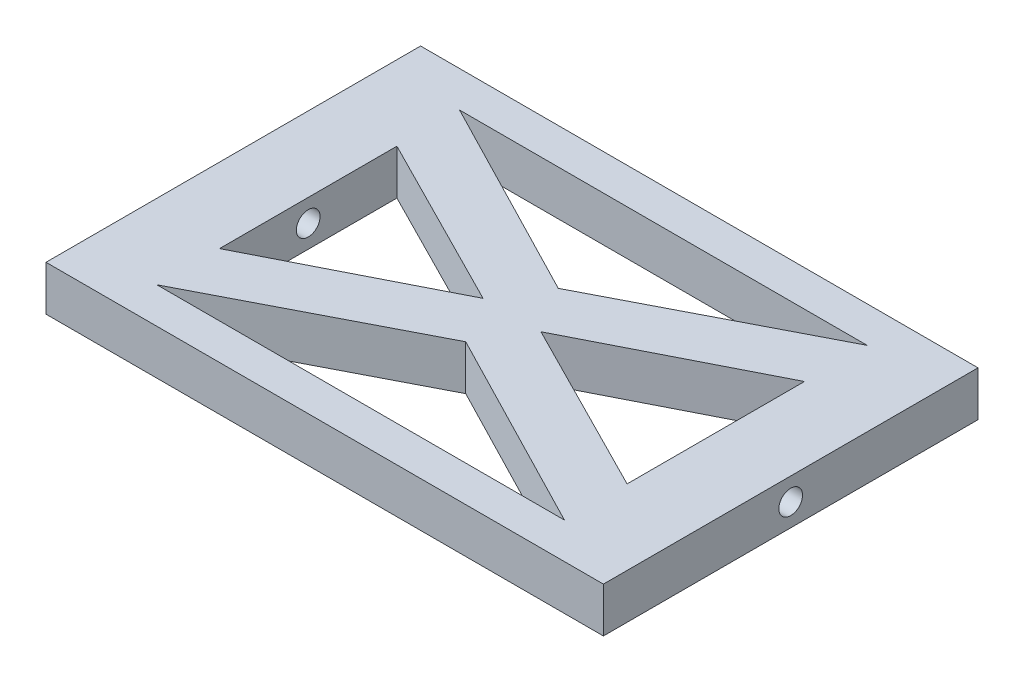
from build123d import *

# Parameters (mm, degrees)
SKETCH1_W           = 47.244
SKETCH1_H           = 31.75
BOSS_EXTRUDE1_DEPTH = 3.81
SKETCH4_R           = 1.0033
CUT_EXTRUDE3_DEPTH  = 7.62
CUT_EXTRUDE4_START  = -7.62
SKETCH5_R           = 1.0033
CUT_EXTRUDE4_DEPTH  = 7.62
CUT_EXTRUDE6_DEPTH  = 29.714641022


with BuildPart() as part:
    # Sketch1 → Boss-Extrude1 (new body)
    with BuildSketch(Plane(origin=(0, 0, 0), x_dir=(1, 0, 0), z_dir=(0, 1, 0))):
        Rectangle(SKETCH1_W, SKETCH1_H)
    extrude(amount=BOSS_EXTRUDE1_DEPTH)

    # Sketch4 → Cut-Extrude3 (cut)
    with BuildSketch(Plane(origin=(23.622, 0, 0), x_dir=(0, 0, -1), z_dir=(1, 0, 0))):
        with Locations((0, 1.905)):
            Circle(SKETCH4_R)
    extrude(amount=-CUT_EXTRUDE3_DEPTH, mode=Mode.SUBTRACT)

    # Sketch5 → Cut-Extrude4 (cut)
    with BuildSketch(Plane.ZY.offset(23.622).offset(CUT_EXTRUDE4_START)):
        with Locations((0, 1.905)):
            Circle(SKETCH5_R)
    extrude(amount=CUT_EXTRUDE4_DEPTH, mode=Mode.SUBTRACT)

    # Sketch6 → Cut-Extrude6 (cut, through all)
    with BuildSketch(Plane(origin=(0, 3.81, 0), x_dir=(1, 0, 0), z_dir=(0, 1, 0))):
        Polygon((17.272, 7.516807478), (2.452684226, 0), (17.272, -7.516807478), align=None)
        Polygon((17.272, -12.827), (0, -3.9213755), (-17.272, -12.827), align=None)
        Polygon((-17.272, -7.516807478), (-2.452684226, 0), (-17.272, 7.516807478), align=None)
        Polygon((0, 3.9213755), (17.272, 12.827), (-17.272, 12.827), align=None)
    extrude(amount=-CUT_EXTRUDE6_DEPTH, mode=Mode.SUBTRACT)


solid = part.part
